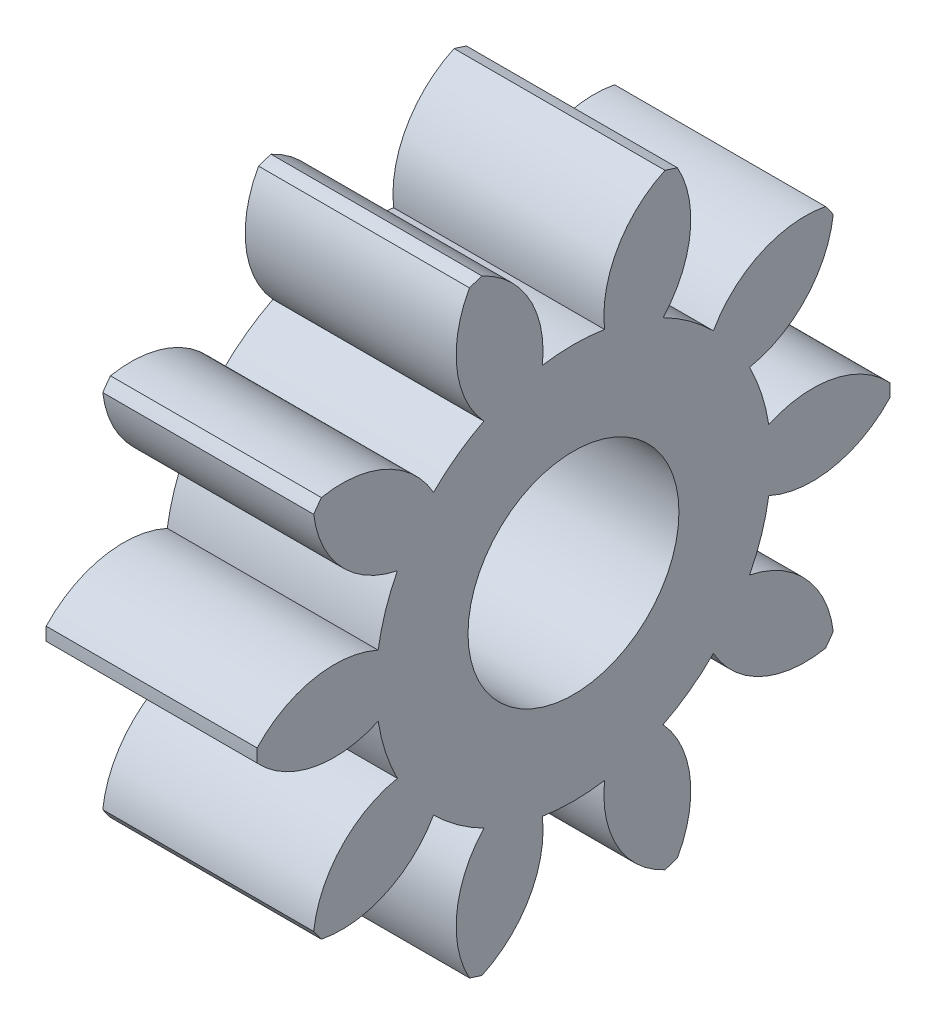
from build123d import *

# Parameters (mm, degrees)
BASPROSKE_W     = 6
BASPROSKE_H     = 9
TOOTHCUT_DEPTH  = 15.071247279
TEETHCUTS_COUNT = 10
BORSKE_R        = 3
BORE_DEPTH      = 50.0000508


with BuildPart() as part:
    # BasProSke → Base-Revolve (revolve)
    with BuildSketch(Plane(origin=(0, 0, 0), x_dir=(1, 0, 0), z_dir=(0, 1, 0))):
        with Locations((3, 4.5)):
            Rectangle(BASPROSKE_W, BASPROSKE_H)
    revolve(axis=Axis((-10, 0, 0), (1, 0, 0)))

    # TooCutSke → ToothCut (cut, through all)
    with BuildSketch(Plane(origin=(0, 0, 0), x_dir=(0, 0, -1), z_dir=(1, 0, 0))):
        with BuildLine():
            ThreePointArc((0.883878355, 5.554109745), (0, 5.624), (-0.883878355, 5.554109745))
            ThreePointArc((-0.883878355, 5.554109745), (-1.258245767, 7.379188248), (-2.637816971, 8.631324741))
            ThreePointArc((-2.637816971, 8.631324741), (0, 9.0254), (2.637816971, 8.631324741))
            ThreePointArc((2.637816971, 8.631324741), (1.258245767, 7.379188248), (0.883878355, 5.554109745))
        make_face()
    toothcut = extrude(amount=TOOTHCUT_DEPTH, mode=Mode.SUBTRACT)

    # TeethCuts: ToothCut ×10 about axis
    teethcuts_axis = Axis((-10, 0, 0), (1, 0, 0))
    for i in range(1, TEETHCUTS_COUNT):
        add(toothcut.rotate(teethcuts_axis, i * 360 / TEETHCUTS_COUNT), mode=Mode.SUBTRACT)

    # BorSke → Bore (cut, symmetric)
    with BuildSketch(Plane(origin=(0, 0, 0), x_dir=(0, 0, -1), z_dir=(1, 0, 0))):
        Circle(BORSKE_R)
    extrude(amount=BORE_DEPTH, both=True, mode=Mode.SUBTRACT)


solid = part.part
